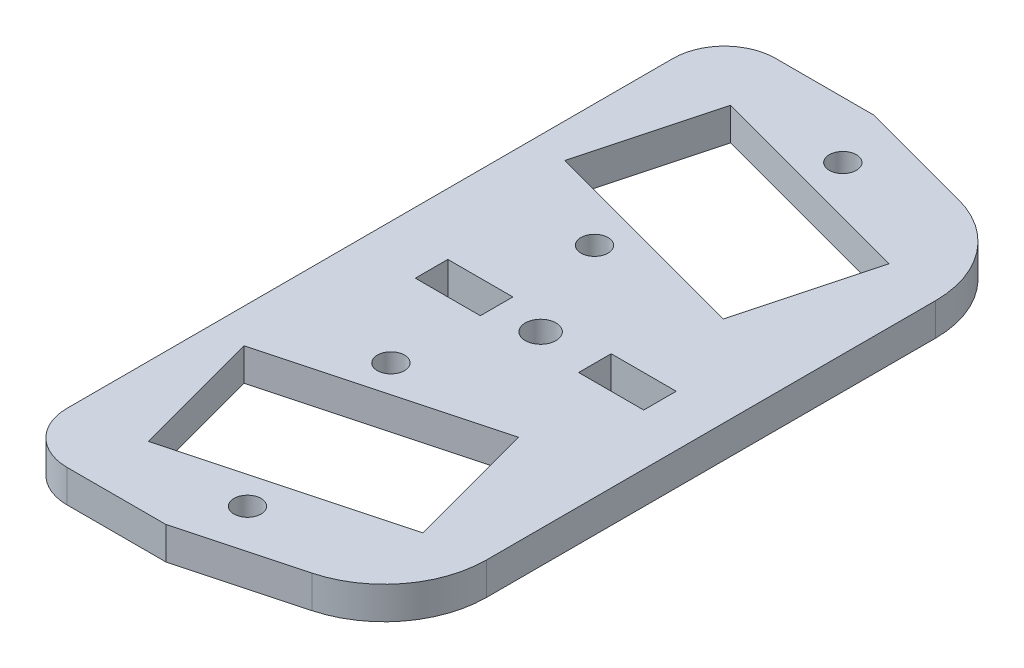
from build123d import *

# Parameters (mm, degrees)
SKETCH1_R           = 1.324800001
SKETCH1_R_2         = 1.5
SKETCH1_W           = 6.35
SKETCH1_H           = 3.175
BOSS_EXTRUDE1_DEPTH = 3.175


with BuildPart() as part:
    # Sketch1 → Boss-Extrude1 (new body)
    with BuildSketch(Plane(origin=(0, 0, 0), x_dir=(1, 0, 0), z_dir=(0, 1, 0))):
        with BuildLine():
            Line((242.25748173, 29.781172289), (251.897227692, 29.781172289))
            Line((251.897227692, 29.781172289), (263.145672181, 26.767160672))
            ThreePointArc((263.145672181, 26.767160672), (268.491015133, 23.1955167), (270.55748173, 17.10790241))
            Line((270.55748173, 17.10790241), (270.55748173, -26.721464525))
            ThreePointArc((270.55748173, -26.721464525), (268.491015133, -32.809078815), (263.145672181, -36.380722788))
            Line((263.145672181, -36.380722788), (251.897227692, -39.394734405))
            Line((251.897227692, -39.394734405), (242.25748173, -39.394734405))
            ThreePointArc((242.25748173, -39.394734405), (238.721947824, -37.930268311), (237.25748173, -34.394734405))
            Line((237.25748173, -34.394734405), (237.25748173, 24.781172289))
            ThreePointArc((237.25748173, 24.781172289), (238.721947824, 28.316706195), (242.25748173, 29.781172289))
        make_face()
        with Locations((254.350862197, 24.256669994)):
            Circle(SKETCH1_R, mode=Mode.SUBTRACT)
        with Locations((249.226245104, 5.131338633)):
            Circle(SKETCH1_R, mode=Mode.SUBTRACT)
        with Locations((249.226245104, -14.744900749)):
            Circle(SKETCH1_R, mode=Mode.SUBTRACT)
        with Locations((254.350862197, -33.870232109)):
            Circle(SKETCH1_R, mode=Mode.SUBTRACT)
        with Locations((253.90748173, -4.806781058)):
            Circle(SKETCH1_R_2, mode=Mode.SUBTRACT)
        Polygon((240.608048315, 10.855734034), (261.740842338, 5.193218942), (265.157881165, 17.945781457), (244.025087143, 23.608296549), align=None, mode=Mode.SUBTRACT)
        Polygon((261.740842338, -14.806781058), (265.157881165, -27.559343572), (244.025087143, -33.221858664), (240.608048315, -20.46929615), align=None, mode=Mode.SUBTRACT)
        with Locations((246.43248173, -4.806781058)):
            Rectangle(SKETCH1_W, SKETCH1_H, mode=Mode.SUBTRACT)
        with Locations((262.38248173, -4.806781058)):
            Rectangle(SKETCH1_W, SKETCH1_H, mode=Mode.SUBTRACT)
    extrude(amount=BOSS_EXTRUDE1_DEPTH)


solid = part.part
